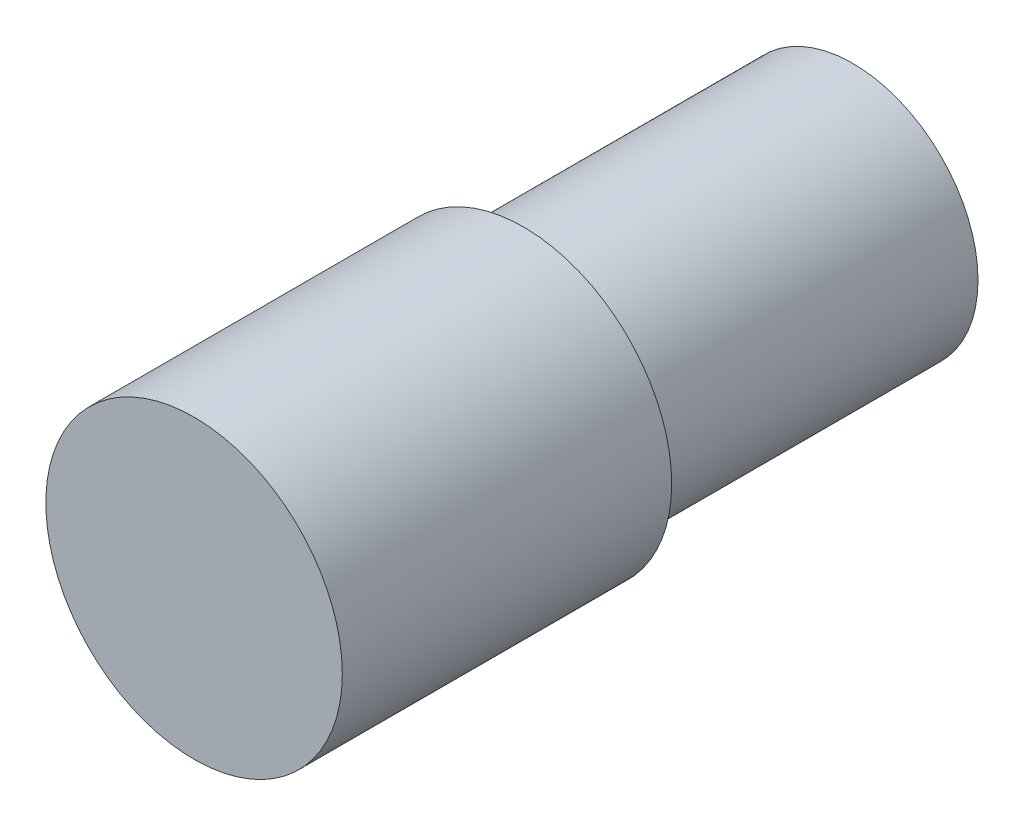
from build123d import *

# Parameters (mm, degrees)
SKETCH1_R      = 3.8
EXTRUDE1_DEPTH = 10
SKETCH2_R      = 4.5
EXTRUDE2_DEPTH = 10


with BuildPart() as part:
    # Sketch1 → Extrude1 (new body)
    with BuildSketch(Plane.XY):
        Circle(SKETCH1_R)
    extrude(amount=EXTRUDE1_DEPTH)

    # Sketch2 → Extrude2 (add)
    with BuildSketch(Plane.XY.offset(10)):
        Circle(SKETCH2_R)
    extrude(amount=EXTRUDE2_DEPTH)


solid = part.part
